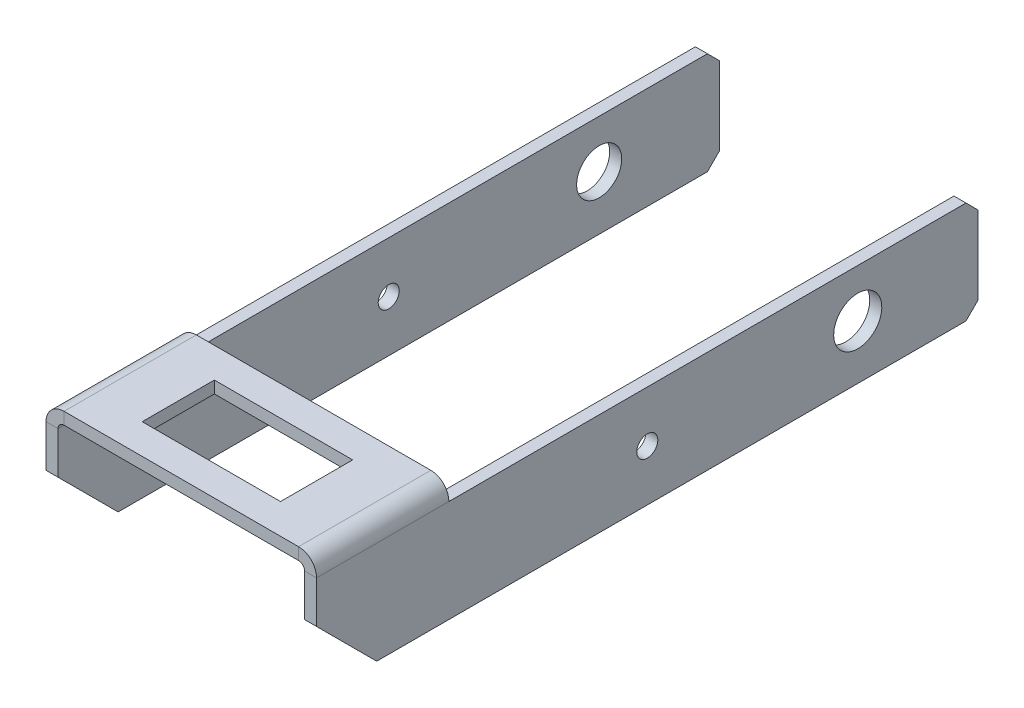
from build123d import *

# Parameters (mm, degrees)
SKETCH1_W                      = 45
SKETCH1_H                      = 22
BASE_FLANGE1_DEPTH             = 2
EDGE_FLANGE3_STRIP_W           = 10
EDGE_FLANGE3_STRIP_H           = 2
EDGE_FLANGE3_STRIP_CUT_DEPTH   = 22
EDGE_FLANGE3_STRIP_2_W         = 10
EDGE_FLANGE3_STRIP_2_H         = 2
EDGE_FLANGE3_STRIP_CUT_2_DEPTH = 22
EDGE_FLANGE3_DEPTH             = 22
EDGE_FLANGE3_PROFILE_W         = 110
EDGE_FLANGE3_PROFILE_H         = 17
EDGE_FLANGE3_FLAT_DEPTH        = 2
EDGE_FLANGE3_BEND_DEPTH        = 22
EDGE_FLANGE3_PROFILE_2_W       = 110
EDGE_FLANGE3_PROFILE_2_H       = 17
EDGE_FLANGE3_FLAT_2_DEPTH      = 2
SKETCH34_R                     = 4
CUT_EXTRUDE1_DEPTH             = 10
SKETCH35_R                     = 3.75
CUT_EXTRUDE2_DEPTH             = 10
SKETCH36_R                     = 1.75
CUT_EXTRUDE3_DEPTH             = 121.203993278
SKETCH37_W                     = 23
SKETCH37_H                     = 12
CUT_EXTRUDE4_DEPTH             = 10
CHAMFER1_SIZE                  = 2
CHAMFER2_SIZE                  = 10


# Sheet-metal steps are written as plain solids
with BuildPart() as part:
    # Sketch1 → Base-Flange1 (new body)
    with BuildSketch(Plane(origin=(0, 0, 0), x_dir=(1, 0, 0), z_dir=(0, 1, 0))):
        with Locations((22.5, 11)):
            Rectangle(SKETCH1_W, SKETCH1_H)
    extrude(amount=BASE_FLANGE1_DEPTH)

    # Edge-Flange3 strip (across the edge) → Edge-Flange3 strip cut (cut)
    with BuildSketch(Plane(origin=(45, 0, -22), x_dir=(-1, 0, 0), z_dir=(0, 0, 1))):
        with Locations((-2, -1)):
            Rectangle(EDGE_FLANGE3_STRIP_W, EDGE_FLANGE3_STRIP_H)
    extrude(amount=EDGE_FLANGE3_STRIP_CUT_DEPTH, mode=Mode.SUBTRACT)

    # Edge-Flange3 strip 2 (across the edge) → Edge-Flange3 strip cut 2 (cut)
    with BuildSketch(Plane(origin=(0, 0, 0), x_dir=(1, 0, 0), z_dir=(0, 0, -1))):
        with Locations((-2, -1)):
            Rectangle(EDGE_FLANGE3_STRIP_2_W, EDGE_FLANGE3_STRIP_2_H)
    extrude(amount=EDGE_FLANGE3_STRIP_CUT_2_DEPTH, mode=Mode.SUBTRACT)

    # Edge-Flange3 bend section (across the edge) → Edge-Flange3 (add)
    with BuildSketch(Plane(origin=(45, 0, -22), x_dir=(-1, 0, 0), z_dir=(0, 0, 1))):
        with BuildLine():
            Line((0, 1), (2, 1))
            ThreePointArc((2, 1), (2.292893219, 0.292893219), (3, 0))
            Line((3, 0), (3, -2))
            ThreePointArc((3, -2), (0.878679656, -1.121320344), (0, 1))
        make_face()
    extrude(amount=EDGE_FLANGE3_DEPTH)

    # Edge-Flange3 profile (on flange) → Edge-Flange3 flat (add)
    with BuildSketch(Plane(origin=(45, 0, 0), x_dir=(0, 0, 1), z_dir=(1, 0, 0))):
        with Locations((-55, 9.5)):
            Rectangle(EDGE_FLANGE3_PROFILE_W, EDGE_FLANGE3_PROFILE_H)
    extrude(amount=-EDGE_FLANGE3_FLAT_DEPTH)

    # Edge-Flange3 bend section 2 (across the edge) → Edge-Flange3 bend (add)
    with BuildSketch(Plane(origin=(0, 0, 0), x_dir=(1, 0, 0), z_dir=(0, 0, -1))):
        with BuildLine():
            Line((0, 1), (2, 1))
            ThreePointArc((2, 1), (2.292893219, 0.292893219), (3, 0))
            Line((3, 0), (3, -2))
            ThreePointArc((3, -2), (0.878679656, -1.121320344), (0, 1))
        make_face()
    extrude(amount=EDGE_FLANGE3_BEND_DEPTH)

    # Edge-Flange3 profile 2 (on flange) → Edge-Flange3 flat 2 (add)
    with BuildSketch(Plane(origin=(0, 0, 0), x_dir=(0, 0, -1), z_dir=(-1, 0, 0))):
        with Locations((55, 9.5)):
            Rectangle(EDGE_FLANGE3_PROFILE_2_W, EDGE_FLANGE3_PROFILE_2_H)
    extrude(amount=-EDGE_FLANGE3_FLAT_2_DEPTH)

    # Sketch34 → Cut-Extrude1 (cut)
    with BuildSketch(Plane(origin=(45, 0, 0), x_dir=(0, 0, -1), z_dir=(1, 0, 0))):
        with Locations(Location((90, -9, 0), (0, 0, 90))):
            Circle(SKETCH34_R)
    extrude(amount=-CUT_EXTRUDE1_DEPTH, mode=Mode.SUBTRACT)

    # Sketch35 → Cut-Extrude2 (cut)
    with BuildSketch(Plane.ZY):
        with Locations(Location((-90, -9, 0), (0, 0, 270))):
            Circle(SKETCH35_R)
    extrude(amount=-CUT_EXTRUDE2_DEPTH, mode=Mode.SUBTRACT)

    # Sketch36 → Cut-Extrude3 (cut, through all)
    with BuildSketch(Plane.ZY):
        with Locations(Location((-55, -9.5, 0), (0, 0, 270))):
            Circle(SKETCH36_R)
    extrude(amount=-CUT_EXTRUDE3_DEPTH, mode=Mode.SUBTRACT)

    # Sketch37 → Cut-Extrude4 (cut)
    with BuildSketch(Plane(origin=(0, 2, 0), x_dir=(1, 0, 0), z_dir=(0, 1, 0))):
        with Locations((22.5, 11)):
            Rectangle(SKETCH37_W, SKETCH37_H)
    extrude(amount=-CUT_EXTRUDE4_DEPTH, mode=Mode.SUBTRACT)

    # Chamfer1
    chamfer1_edges = [part.edges().sort_by_distance(p)[0] for p in [
        (44, -1, -110),
        (44, -18, -110),
        (1, -1, -110),
        (1, -18, -110),
    ]]
    chamfer(chamfer1_edges, length=CHAMFER1_SIZE)

    # Chamfer2
    chamfer2_edges = [part.edges().sort_by_distance(p)[0] for p in [
        (44, -18, 0),
        (1, -18, 0),
    ]]
    chamfer(chamfer2_edges, length=CHAMFER2_SIZE)


solid = part.part
